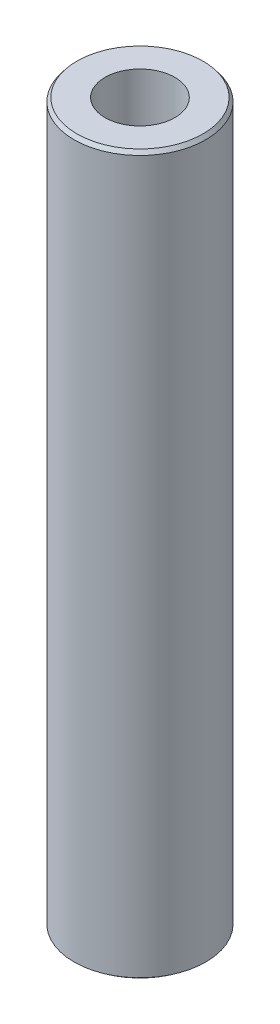
from build123d import *
from OCP.BRepFilletAPI import BRepFilletAPI_MakeChamfer

# Parameters (mm, degrees)
SKETCH1_R           = 55
BOSS_EXTRUDE1_DEPTH = 600
SKETCH2_R           = 29.164971167
CUT_EXTRUDE1_DEPTH  = 606.020660804
CHAMFER1_SIZE       = 3.069775042
CHAMFER1_SIZE2      = 2.341778442


with BuildPart() as part:
    # Sketch1 → Boss-Extrude1 (new body)
    with BuildSketch(Plane(origin=(0, 0, 0), x_dir=(1, 0, 0), z_dir=(0, 1, 0))):
        Circle(SKETCH1_R)
    extrude(amount=BOSS_EXTRUDE1_DEPTH)

    # Sketch2 → Cut-Extrude1 (cut, through all)
    with BuildSketch(Plane(origin=(0, 0, 0), x_dir=(1, 0, 0), z_dir=(0, 1, 0))):
        Circle(SKETCH2_R)
    extrude(amount=CUT_EXTRUDE1_DEPTH, mode=Mode.SUBTRACT)

    # Chamfer1: one chamfer whose edges measure the first distance from different faces: ONE call of the kernel's chamfer builder (chamfer() names one face for all edges)
    chamfer1_edges_1 = [part.edges().sort_by_distance(p)[0] for p in [
        (-55, 600, 0),
    ]]
    chamfer1_side_1 = [part.faces().sort_by_distance(p)[0] for p in [
        (-55, 300, 0),
    ]]
    chamfer1_edges_2 = [part.edges().sort_by_distance(p)[0] for p in [
        (-55, 0, 0),
    ]]
    chamfer1_side_2 = [part.faces().sort_by_distance(p)[0] for p in [
        (-53.444365081, 0, 0),
    ]]
    chamfer1 = BRepFilletAPI_MakeChamfer(part.part.solid().wrapped)
    for e in chamfer1_edges_1:
        chamfer1.Add(CHAMFER1_SIZE, CHAMFER1_SIZE2, e.wrapped, chamfer1_side_1[0].wrapped)  # the first distance lies on this face
    for e in chamfer1_edges_2:
        chamfer1.Add(CHAMFER1_SIZE, CHAMFER1_SIZE2, e.wrapped, chamfer1_side_2[0].wrapped)  # the first distance lies on this face
    add(Compound.cast(chamfer1.Shape()), mode=Mode.REPLACE)


solid = part.part
